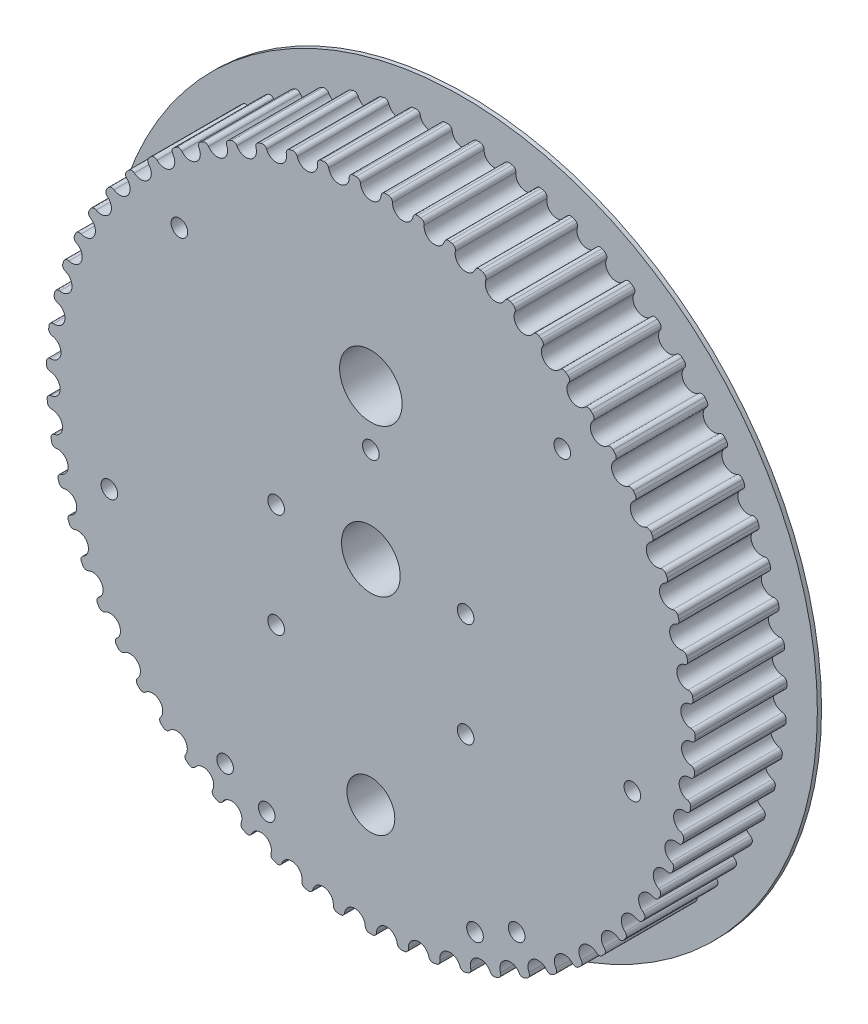
from build123d import *

# Parameters (mm, degrees)
BOSS_EXTRUDE1_DEPTH = 22
SKETCH2_R           = 85.214091318
BOSS_EXTRUDE2_DEPTH = 1
SKETCH3_R           = 7.05
SKETCH3_R_2         = 5.75
SKETCH3_R_3         = 7.5
CUT_EXTRUDE1_DEPTH  = 123.686114611
SKETCH4_R           = 2
CUT_EXTRUDE2_DEPTH  = 18


with BuildPart() as part:
    # Sketch1 → Boss-Extrude1 (new body)
    with BuildSketch(Plane.XY):
        with BuildLine():
            ThreePointArc((2.48146659, 76.908121514), (0, 74.624091318), (-2.48146659, 76.908121514))
            ThreePointArc((-2.48146659, 76.908121514), (-2.817624817, 77.57630379), (-3.523265194, 77.824379512))
            ThreePointArc((-3.523265194, 77.824379512), (-3.703241715, 77.81602306), (-3.883198428, 77.807250395))
            ThreePointArc((-3.883198428, 77.807250395), (-4.063134372, 77.798061565), (-4.243048583, 77.788456617))
            ThreePointArc((-4.243048583, 77.788456617), (-4.920482109, 77.471354546), (-5.188440419, 76.773022067))
            ThreePointArc((-5.188440419, 76.773022067), (-7.430160077, 74.253267445), (-10.12671167, 76.278873497))
            ThreePointArc((-10.12671167, 76.278873497), (-10.527728921, 76.910264875), (-11.254563179, 77.08684876))
            ThreePointArc((-11.254563179, 77.08684876), (-11.432813322, 77.060613959), (-11.611002314, 77.033966985))
            ThreePointArc((-11.611002314, 77.033966985), (-11.789129204, 77.006907981), (-11.967193036, 76.979437092))
            ThreePointArc((-11.967193036, 76.979437092), (-12.609687073, 76.596460174), (-12.806782377, 75.874917834))
            ThreePointArc((-12.806782377, 75.874917834), (-14.786475884, 73.144481241), (-17.67131294, 74.891531766))
            ThreePointArc((-17.67131294, 74.891531766), (-18.133203726, 75.479857193), (-18.874008258, 75.583194272))
            ThreePointArc((-18.874008258, 75.583194272), (-19.048760494, 75.539341854), (-19.223410843, 75.495085401))
            ThreePointArc((-19.223410843, 75.495085401), (-19.397958373, 75.450425149), (-19.572402149, 75.405361336))
            ThreePointArc((-19.572402149, 75.405361336), (-20.173571302, 74.960315769), (-20.297844778, 74.22273458))
            ThreePointArc((-20.297844778, 74.22273458), (-21.995837052, 71.30875232), (-25.040288763, 72.759884345))
            ThreePointArc((-25.040288763, 72.759884345), (-25.558462605, 73.299296781), (-26.305874964, 73.328360042))
            ThreePointArc((-26.305874964, 73.328360042), (-26.475392525, 73.267325833), (-26.644768478, 73.205899741))
            ThreePointArc((-26.644768478, 73.205899741), (-26.814001917, 73.144082094), (-26.983091936, 73.081873222))
            ThreePointArc((-26.983091936, 73.081873222), (-27.536961516, 72.579182069), (-27.587178078, 71.832892444))
            ThreePointArc((-27.587178078, 71.832892444), (-28.986593708, 68.764324982), (-32.160402946, 69.905116505))
            ThreePointArc((-32.160402946, 69.905116505), (-32.729710001, 70.390255026), (-33.476302066, 70.344755626))
            ThreePointArc((-33.476302066, 70.344755626), (-33.638900212, 70.267146211), (-33.801318434, 70.18916096))
            ThreePointArc((-33.801318434, 70.18916096), (-33.963555864, 70.11080029), (-34.125611633, 70.032064619))
            ThreePointArc((-34.125611633, 70.032064619), (-34.626677035, 69.476723849), (-34.602337609, 68.729142751))
            ThreePointArc((-34.602337609, 68.729142751), (-35.689268574, 65.536486889), (-38.960892596, 66.355600211))
            ThreePointArc((-38.960892596, 66.355600211), (-39.575674834, 66.781643292), (-40.314026638, 66.662033425))
            ThreePointArc((-40.314026638, 66.662033425), (-40.468089395, 66.568620121), (-40.621935701, 66.474850764))
            ThreePointArc((-40.621935701, 66.474850764), (-40.775564733, 66.380725854), (-40.92897567, 66.286245894))
            ThreePointArc((-40.92897567, 66.286245894), (-41.37225708, 65.683774735), (-41.273603563, 64.942331958))
            ThreePointArc((-41.273603563, 64.942331958), (-42.037247454, 61.657317745), (-45.374171391, 62.146612151))
            ThreePointArc((-45.374171391, 62.146612151), (-46.02831883, 62.509325584), (-46.751092302, 62.316793986))
            ThreePointArc((-46.751092302, 62.316793986), (-46.895088524, 62.208505178), (-47.03883392, 62.099883635))
            ThreePointArc((-47.03883392, 62.099883635), (-47.182327721, 61.990929941), (-47.325569158, 61.881644677))
            ThreePointArc((-47.325569158, 61.881644677), (-47.706661048, 61.238030757), (-47.534673901, 60.510095095))
            ThreePointArc((-47.534673901, 60.510095095), (-47.967441284, 57.165370477), (-51.336501286, 57.319983138))
            ThreePointArc((-51.336501286, 57.319983138), (-52.023512715, 57.615762115), (-52.723524606, 57.352222252))
            ThreePointArc((-52.723524606, 57.352222252), (-52.856023196, 57.230134161), (-52.988239076, 57.107739964))
            ThreePointArc((-52.988239076, 57.107739964), (-53.120171538, 56.985040316), (-53.251819879, 56.862035874))
            ThreePointArc((-53.251819879, 56.862035874), (-53.566934785, 56.183675717), (-53.323323294, 55.47648172))
            ThreePointArc((-53.323323294, 55.47648172), (-53.420913131, 52.105288075), (-56.788625967, 51.923682381))
            ThreePointArc((-56.788625967, 51.923682381), (-57.501673558, 52.149587317), (-58.171966836, 51.817658367))
            ThreePointArc((-58.171966836, 51.817658367), (-58.291650962, 51.682984359), (-58.411023305, 51.548033916))
            ThreePointArc((-58.411023305, 51.548033916), (-58.530083226, 51.412807759), (-58.648830088, 51.277306612))
            ThreePointArc((-58.648830088, 51.277306612), (-58.894836258, 50.570942066), (-58.582021544, 49.891518147))
            ThreePointArc((-58.582021544, 49.891518147), (-58.343463943, 46.52735991), (-61.67635977, 46.011340741))
            ThreePointArc((-61.67635977, 46.011340741), (-62.408356935, 46.165126492), (-63.042269924, 45.768107312))
            ThreePointArc((-63.042269924, 45.768107312), (-63.147950112, 45.622185839), (-63.253292542, 45.476020348))
            ThreePointArc((-63.253292542, 45.476020348), (-63.35829665, 45.329611621), (-63.462961876, 45.18296044))
            ThreePointArc((-63.462961876, 45.18296044), (-63.637414389, 44.455611673), (-63.258505345, 43.810710252))
            ThreePointArc((-63.258505345, 43.810710252), (-62.686171199, 40.487021939), (-65.9511262, 39.641717725))
            ThreePointArc((-65.9511262, 39.641717725), (-66.694798023, 39.721855898), (-67.286030611, 39.263692245))
            ThreePointArc((-67.286030611, 39.263692245), (-67.376656564, 39.10797354), (-67.46692214, 38.952045659))
            ThreePointArc((-67.46692214, 38.952045659), (-67.556826858, 38.795909436), (-67.646370236, 38.639565707))
            ThreePointArc((-67.646370236, 38.639565707), (-67.747535305, 37.898461439), (-67.306297699, 37.294491835))
            ThreePointArc((-67.306297699, 37.294491835), (-66.405875122, 34.044305755), (-69.570440708, 32.878117508))
            ThreePointArc((-69.570440708, 32.878117508), (-70.318396244, 32.883811655), (-70.861072497, 32.369056964))
            ThreePointArc((-70.861072497, 32.369056964), (-70.935743532, 32.20508863), (-71.010035156, 32.04094804))
            ThreePointArc((-71.010035156, 32.04094804), (-71.083946969, 31.876636074), (-71.157478577, 31.712153611))
            ThreePointArc((-71.157478577, 31.712153611), (-71.184350778, 30.964659268), (-70.685169829, 30.407624003))
            ThreePointArc((-70.685169829, 30.407624003), (-69.465607625, 27.263241965), (-72.498332921, 25.787759789))
            ThreePointArc((-72.498332921, 25.787759789), (-73.243138652, 25.718953318), (-73.731865208, 25.152723453))
            ThreePointArc((-73.731865208, 25.152723453), (-73.789839212, 24.98213508), (-73.847418539, 24.811413085))
            ThreePointArc((-73.847418539, 24.811413085), (-73.904602879, 24.640558382), (-73.961391928, 24.469571885))
            ThreePointArc((-73.961391928, 24.469571885), (-73.913704193, 23.723116402), (-73.361540984, 23.218551543))
            ThreePointArc((-73.361540984, 23.218551543), (-71.83495971, 20.211223827), (-74.70570413, 18.441111727))
            ThreePointArc((-74.70570413, 18.441111727), (-75.439957841, 18.298488468), (-75.869877517, 17.686410876))
            ThreePointArc((-75.869877517, 17.686410876), (-75.910578319, 17.510897847), (-75.950873099, 17.335291159))
            ThreePointArc((-75.950873099, 17.335291159), (-75.990761643, 17.15959175), (-76.030243737, 16.98380056))
            ThreePointArc((-76.030243737, 16.98380056), (-75.908470008, 16.245802548), (-75.308812185, 15.798722686))
            ThreePointArc((-75.308812185, 15.798722686), (-73.490383692, 12.958337467), (-76.170616488, 10.911187612))
            ThreePointArc((-76.170616488, 10.911187612), (-76.887020837, 10.696165019), (-77.253860898, 10.044322801))
            ThreePointArc((-77.253860898, 10.044322801), (-77.276883994, 9.865629445), (-77.299493761, 9.686883322))
            ThreePointArc((-77.299493761, 9.686883322), (-77.321690077, 9.508085386), (-77.343472825, 9.329236595))
            ThreePointArc((-77.343472825, 9.329236595), (-77.148823344, 8.607030608), (-76.507630577, 8.221879025))
            ThreePointArc((-76.507630577, 8.221879025), (-74.415427224, 5.576665328), (-76.878511038, 3.272823212))
            ThreePointArc((-76.878511038, 3.272823212), (-77.569946077, 2.987538276), (-77.870060701, 2.302409734))
            ThreePointArc((-77.870060701, 2.302409734), (-77.875177277, 2.122311986), (-77.879877325, 1.942202886))
            ThreePointArc((-77.879877325, 1.942202886), (-77.884160817, 1.762083398), (-77.888027733, 1.581954485))
            ThreePointArc((-77.888027733, 1.581954485), (-77.622437014, 0.882718132), (-76.946081764, 0.563322636))
            ThreePointArc((-76.946081764, 0.563322636), (-74.600896808, -1.860430217), (-76.822352407, -4.398067976))
            ThreePointArc((-76.822352407, -4.398067976), (-77.481946343, -4.750779964), (-77.712352856, -5.462385715))
            ThreePointArc((-77.712352856, -5.462385715), (-77.699512062, -5.642097964), (-77.686255679, -5.821780035))
            ThreePointArc((-77.686255679, -5.821780035), (-77.672583776, -6.001430967), (-77.658496428, -6.181049799))
            ThreePointArc((-77.658496428, -6.181049799), (-77.324604031, -6.850367194), (-76.619808221, -7.100832306))
            ThreePointArc((-76.619808221, -7.100832306), (-74.044949163, -9.27903597), (-76.002698723, -12.025249187))
            ThreePointArc((-76.002698723, -12.025249187), (-76.623896215, -12.441882819), (-76.782304735, -13.172893522))
            ThreePointArc((-76.782304735, -13.172893522), (-76.751634188, -13.350434209), (-76.720553122, -13.52790349))
            ThreePointArc((-76.720553122, -13.52790349), (-76.689061702, -13.705300415), (-76.657160097, -13.882624034))
            ThreePointArc((-76.657160097, -13.882624034), (-76.258284394, -14.515370493), (-75.532052601, -14.694415986))
            ThreePointArc((-75.532052601, -14.694415986), (-72.753109547, -16.605422496), (-74.427696074, -19.53291807))
            ThreePointArc((-74.427696074, -19.53291807), (-75.004323383, -20.009332652), (-75.089159573, -20.752483194))
            ThreePointArc((-75.089159573, -20.752483194), (-75.040964091, -20.926087842), (-74.99236724, -21.099580563))
            ThreePointArc((-74.99236724, -21.099580563), (-74.943369278, -21.272960429), (-74.893970468, -21.446226513))
            ThreePointArc((-74.893970468, -21.446226513), (-74.434075667, -22.036113518), (-73.693625507, -22.141959958))
            ThreePointArc((-73.693625507, -22.141959958), (-70.738216844, -23.766776872), (-72.112997543, -26.846460038))
            ThreePointArc((-72.112997543, -26.846460038), (-72.639323888, -27.377920748), (-72.649744609, -28.125825364))
            ThreePointArc((-72.649744609, -28.125825364), (-72.58450318, -28.293768612), (-72.51887352, -28.461560525))
            ThreePointArc((-72.51887352, -28.461560525), (-72.45285598, -28.629200206), (-72.386450914, -28.796686759))
            ThreePointArc((-72.386450914, -28.796686759), (-71.870107654, -29.337851747), (-71.122798056, -29.369447185))
            ThreePointArc((-71.122798056, -29.369447185), (-68.02029596, -30.691926342), (-69.081607645, -33.893189824))
            ThreePointArc((-69.081607645, -33.893189824), (-69.552402157, -34.474414767), (-69.488303843, -35.219640447))
            ThreePointArc((-69.488303843, -35.219640447), (-69.406664866, -35.380253197), (-69.324654655, -35.540676711))
            ThreePointArc((-69.324654655, -35.540676711), (-69.242273649, -35.700910129), (-69.159522289, -35.860952594))
            ThreePointArc((-69.159522289, -35.860952594), (-68.591862222, -36.348017226), (-67.845120284, -36.305047651))
            ThreePointArc((-67.845120284, -36.305047651), (-64.626358816, -37.312045659), (-65.363653693, -40.603073863))
            ThreePointArc((-65.363653693, -40.603073863), (-65.774237406, -41.228286564), (-65.636257094, -41.963426919))
            ThreePointArc((-65.636257094, -41.963426919), (-65.539031934, -42.115112932), (-65.441456227, -42.266573685))
            ThreePointArc((-65.441456227, -42.266573685), (-65.343530494, -42.417808367), (-65.24525526, -42.56881617))
            ThreePointArc((-65.24525526, -42.56881617), (-64.631920047, -42.996939778), (-63.893167225, -42.879832242))
            ThreePointArc((-63.893167225, -42.879832242), (-60.590135883, -43.561341103), (-60.996086385, -46.909426312))
            ThreePointArc((-60.996086385, -46.909426312), (-61.342378733, -47.572413127), (-61.131887735, -48.290162002))
            ThreePointArc((-61.131887735, -48.290162002), (-61.020042658, -48.431413753), (-60.907871206, -48.57240646))
            ThreePointArc((-60.907871206, -48.57240646), (-60.795373976, -48.713139369), (-60.682551572, -48.853611727))
            ThreePointArc((-60.682551572, -48.853611727), (-60.029636814, -49.218539426), (-59.306215166, -49.028457797))
            ThreePointArc((-59.306215166, -49.028457797), (-55.951740959, -49.377704369), (-56.022312567, -52.749571807))
            ThreePointArc((-56.022312567, -52.749571807), (-56.300871941, -53.443743675), (-56.01996221, -54.136967759))
            ThreePointArc((-56.01996221, -54.136967759), (-55.894608784, -54.266381425), (-55.768956396, -54.395504838))
            ThreePointArc((-55.768956396, -54.395504838), (-55.643005719, -54.524337307), (-55.516757424, -54.652878142))
            ThreePointArc((-55.516757424, -54.652878142), (-54.830752081, -54.950983117), (-54.129851296, -54.68981651))
            ThreePointArc((-54.129851296, -54.68981651), (-50.757272496, -54.703329824), (-50.491763838, -58.065468359))
            ThreePointArc((-50.491763838, -58.065468359), (-50.699821789, -58.783926288), (-50.351285133, -59.445736009))
            ThreePointArc((-50.351285133, -59.445736009), (-50.213669176, -59.562025419), (-50.075784643, -59.677996251))
            ThreePointArc((-50.075784643, -59.677996251), (-49.937632271, -59.793647884), (-49.799212798, -59.908979701))
            ThreePointArc((-49.799212798, -59.908979701), (-49.0869347, -60.13729925), (-48.415520645, -59.807643257))
            ThreePointArc((-48.415520645, -59.807643257), (-45.058355455, -59.485289012), (-44.459405275, -62.8042842))
            ThreePointArc((-44.459405275, -62.8042842), (-44.594894031, -63.539887832), (-44.182194362, -64.163705827))
            ThreePointArc((-44.182194362, -64.163705827), (-44.033683565, -64.265715244), (-43.884937245, -64.367380925))
            ThreePointArc((-43.884937245, -64.367380925), (-43.735956199, -64.468702325), (-43.586741223, -64.569678903))
            ThreePointArc((-43.586741223, -64.569678903), (-42.855269308, -64.725943885), (-42.220014798, -64.331074775))
            ThreePointArc((-42.220014798, -64.331074775), (-38.911628234, -63.676056672), (-37.985189168, -66.918922847))
            ThreePointArc((-37.985189168, -66.918922847), (-38.04676218, -67.664361424), (-37.574001095, -68.24398791))
            ThreePointArc((-37.574001095, -68.24398791), (-37.416071423, -68.330703519), (-37.257941624, -68.41705365))
            ThreePointArc((-37.257941624, -68.41705365), (-37.099612544, -68.503037839), (-36.941085031, -68.588655628))
            ThreePointArc((-36.941085031, -68.588655628), (-36.197688996, -68.671313011), (-35.604907476, -68.21515517))
            ThreePointArc((-35.604907476, -68.21515517), (-32.378179769, -67.233983073), (-31.133459186, -70.368491176))
            ThreePointArc((-31.133459186, -70.368491176), (-31.120504514, -71.116356192), (-30.592380524, -71.646030581))
            ThreePointArc((-30.592380524, -71.646030581), (-30.426601553, -71.716590564), (-30.26065984, -71.786766957))
            ThreePointArc((-30.26065984, -71.786766957), (-30.094556273, -71.856559387), (-29.928291739, -71.925967478))
            ThreePointArc((-29.928291739, -71.925967478), (-29.180359789, -71.934195776), (-28.635942587, -71.421282706))
            ThreePointArc((-28.635942587, -71.421282706), (-25.522942408, -70.123707945), (-23.972310899, -73.118705824))
            ThreePointArc((-23.972310899, -73.118705824), (-23.884957293, -73.861564663), (-23.306719131, -74.336022812))
            ThreePointArc((-23.306719131, -74.336022812), (-23.134738447, -74.389725911), (-22.962634024, -74.443031123))
            ThreePointArc((-22.962634024, -74.443031123), (-22.790406781, -74.495938164), (-22.618057639, -74.54844675))
            ThreePointArc((-22.618057639, -74.54844675), (-21.873023056, -74.482164185), (-21.382380835, -73.917593447))
            ThreePointArc((-21.382380835, -73.917593447), (-18.414046579, -72.316511902), (-16.572915017, -75.142233924))
            ThreePointArc((-16.572915017, -75.142233924), (-16.412030635, -75.87270372), (-15.789425092, -76.287230251))
            ThreePointArc((-15.789425092, -76.287230251), (-15.612951917, -76.323542741), (-15.436395234, -76.359447001))
            ThreePointArc((-15.436395234, -76.359447001), (-15.259755987, -76.394942839), (-15.083035119, -76.430030065))
            ThreePointArc((-15.083035119, -76.430030065), (-14.348302394, -76.289895384), (-13.916311377, -75.679277936))
            ThreePointArc((-13.916311377, -75.679277936), (-11.122143681, -73.790601875), (-9.008810059, -76.418964744))
            ThreePointArc((-9.008810059, -76.418964744), (-8.775993843, -77.12978576), (-8.115208653, -77.480260923))
            ThreePointArc((-8.115208653, -77.480260923), (-7.935996857, -77.498821914), (-7.756742614, -77.516968389))
            ThreePointArc((-7.756742614, -77.516968389), (-7.577446882, -77.53470025), (-7.398110621, -77.552017404))
            ThreePointArc((-7.398110621, -77.552017404), (-6.680981856, -77.339423328), (-6.311935363, -76.68882776))
            ThreePointArc((-6.311935363, -76.68882776), (-3.719703923, -74.531327694), (-1.355171499, -76.93620956))
            ThreePointArc((-1.355171499, -76.93620956), (-1.052737282, -77.620317337), (-0.360339625, -77.903257952))
            ThreePointArc((-0.360339625, -77.903257952), (-0.180170294, -77.903882976), (0, -77.904091318))
            ThreePointArc((0, -77.904091318), (0.180170294, -77.903882976), (0.360339625, -77.903257952))
            ThreePointArc((0.360339625, -77.903257952), (1.052737282, -77.620317337), (1.355171499, -76.93620956))
            ThreePointArc((1.355171499, -76.93620956), (3.719703923, -74.531327694), (6.311935363, -76.68882776))
            ThreePointArc((6.311935363, -76.68882776), (6.680981856, -77.339423328), (7.398110621, -77.552017404))
            ThreePointArc((7.398110621, -77.552017404), (7.577446882, -77.53470025), (7.756742614, -77.516968389))
            ThreePointArc((7.756742614, -77.516968389), (7.935996857, -77.498821914), (8.115208653, -77.480260923))
            ThreePointArc((8.115208653, -77.480260923), (8.775993843, -77.12978576), (9.008810059, -76.418964744))
            ThreePointArc((9.008810059, -76.418964744), (11.122143681, -73.790601875), (13.916311377, -75.679277936))
            ThreePointArc((13.916311377, -75.679277936), (14.348302394, -76.289895384), (15.083035119, -76.430030065))
            ThreePointArc((15.083035119, -76.430030065), (15.259755987, -76.394942839), (15.436395234, -76.359447001))
            ThreePointArc((15.436395234, -76.359447001), (15.612951917, -76.323542741), (15.789425092, -76.287230251))
            ThreePointArc((15.789425092, -76.287230251), (16.412030635, -75.87270372), (16.572915017, -75.142233924))
            ThreePointArc((16.572915017, -75.142233924), (18.414046579, -72.316511902), (21.382380835, -73.917593447))
            ThreePointArc((21.382380835, -73.917593447), (21.873023056, -74.482164185), (22.618057639, -74.54844675))
            ThreePointArc((22.618057639, -74.54844675), (22.79040678, -74.495938164), (22.962634024, -74.443031123))
            ThreePointArc((22.962634024, -74.443031123), (23.134738447, -74.389725911), (23.306719131, -74.336022812))
            ThreePointArc((23.306719131, -74.336022812), (23.884957293, -73.861564663), (23.972310899, -73.118705824))
            ThreePointArc((23.972310899, -73.118705824), (25.522942408, -70.123707945), (28.635942587, -71.421282706))
            ThreePointArc((28.635942587, -71.421282706), (29.180359789, -71.934195776), (29.928291739, -71.925967478))
            ThreePointArc((29.928291739, -71.925967478), (30.094556273, -71.856559387), (30.26065984, -71.786766957))
            ThreePointArc((30.26065984, -71.786766957), (30.426601553, -71.716590564), (30.592380524, -71.646030581))
            ThreePointArc((30.592380524, -71.646030581), (31.120504514, -71.116356192), (31.133459186, -70.368491176))
            ThreePointArc((31.133459186, -70.368491176), (32.378179769, -67.233983073), (35.604907476, -68.21515517))
            ThreePointArc((35.604907476, -68.21515517), (36.197688996, -68.671313011), (36.941085031, -68.588655628))
            ThreePointArc((36.941085031, -68.588655628), (37.099612544, -68.503037839), (37.257941624, -68.41705365))
            ThreePointArc((37.257941624, -68.41705365), (37.416071423, -68.330703519), (37.574001095, -68.24398791))
            ThreePointArc((37.574001095, -68.24398791), (38.04676218, -67.664361424), (37.985189168, -66.918922847))
            ThreePointArc((37.985189168, -66.918922847), (38.911628234, -63.676056672), (42.220014798, -64.331074775))
            ThreePointArc((42.220014798, -64.331074775), (42.855269308, -64.725943885), (43.586741223, -64.569678903))
            ThreePointArc((43.586741223, -64.569678903), (43.735956199, -64.468702325), (43.884937245, -64.367380925))
            ThreePointArc((43.884937245, -64.367380925), (44.033683565, -64.265715244), (44.182194362, -64.163705827))
            ThreePointArc((44.182194362, -64.163705827), (44.594894031, -63.539887832), (44.459405275, -62.8042842))
            ThreePointArc((44.459405275, -62.8042842), (45.058355455, -59.485289012), (48.415520645, -59.807643257))
            ThreePointArc((48.415520645, -59.807643257), (49.0869347, -60.13729925), (49.799212798, -59.908979701))
            ThreePointArc((49.799212798, -59.908979701), (49.937632271, -59.793647884), (50.075784643, -59.677996251))
            ThreePointArc((50.075784643, -59.677996251), (50.213669176, -59.562025419), (50.351285133, -59.445736009))
            ThreePointArc((50.351285133, -59.445736009), (50.699821789, -58.783926288), (50.491763838, -58.065468359))
            ThreePointArc((50.491763838, -58.065468359), (50.757272496, -54.703329824), (54.129851296, -54.68981651))
            ThreePointArc((54.129851296, -54.68981651), (54.830752081, -54.950983117), (55.516757424, -54.652878142))
            ThreePointArc((55.516757424, -54.652878142), (55.643005719, -54.524337307), (55.768956396, -54.395504838))
            ThreePointArc((55.768956396, -54.395504838), (55.894608784, -54.266381425), (56.01996221, -54.136967759))
            ThreePointArc((56.01996221, -54.136967759), (56.300871941, -53.443743675), (56.022312567, -52.749571807))
            ThreePointArc((56.022312567, -52.749571807), (55.951740959, -49.377704369), (59.306215166, -49.028457797))
            ThreePointArc((59.306215166, -49.028457797), (60.029636814, -49.218539426), (60.682551572, -48.853611727))
            ThreePointArc((60.682551572, -48.853611727), (60.795373976, -48.713139369), (60.907871206, -48.57240646))
            ThreePointArc((60.907871206, -48.57240646), (61.020042658, -48.431413753), (61.131887735, -48.290162002))
            ThreePointArc((61.131887735, -48.290162002), (61.342378733, -47.572413127), (60.996086385, -46.909426312))
            ThreePointArc((60.996086385, -46.909426312), (60.590135883, -43.561341103), (63.893167225, -42.879832242))
            ThreePointArc((63.893167225, -42.879832242), (64.631920047, -42.996939778), (65.24525526, -42.56881617))
            ThreePointArc((65.24525526, -42.56881617), (65.343530494, -42.417808367), (65.441456227, -42.266573685))
            ThreePointArc((65.441456227, -42.266573685), (65.539031934, -42.115112932), (65.636257094, -41.963426919))
            ThreePointArc((65.636257094, -41.963426919), (65.774237406, -41.228286564), (65.363653693, -40.603073863))
            ThreePointArc((65.363653693, -40.603073863), (64.626358816, -37.312045659), (67.845120284, -36.305047651))
            ThreePointArc((67.845120284, -36.305047651), (68.591862222, -36.348017226), (69.159522289, -35.860952594))
            ThreePointArc((69.159522289, -35.860952594), (69.242273649, -35.700910129), (69.324654655, -35.540676711))
            ThreePointArc((69.324654655, -35.540676711), (69.406664866, -35.380253197), (69.488303843, -35.219640447))
            ThreePointArc((69.488303843, -35.219640447), (69.552402157, -34.474414767), (69.081607645, -33.893189824))
            ThreePointArc((69.081607645, -33.893189824), (68.02029596, -30.691926342), (71.122798056, -29.369447185))
            ThreePointArc((71.122798056, -29.369447185), (71.870107654, -29.337851747), (72.386450914, -28.796686759))
            ThreePointArc((72.386450914, -28.796686759), (72.45285598, -28.629200206), (72.51887352, -28.461560525))
            ThreePointArc((72.51887352, -28.461560525), (72.58450318, -28.293768612), (72.649744609, -28.125825364))
            ThreePointArc((72.649744609, -28.125825364), (72.639323888, -27.377920748), (72.112997543, -26.846460038))
            ThreePointArc((72.112997543, -26.846460038), (70.738216844, -23.766776872), (73.693625507, -22.141959958))
            ThreePointArc((73.693625507, -22.141959958), (74.434075667, -22.036113518), (74.893970468, -21.446226513))
            ThreePointArc((74.893970468, -21.446226513), (74.943369278, -21.272960429), (74.99236724, -21.099580563))
            ThreePointArc((74.99236724, -21.099580563), (75.040964091, -20.926087842), (75.089159573, -20.752483194))
            ThreePointArc((75.089159573, -20.752483194), (75.004323383, -20.009332652), (74.427696074, -19.53291807))
            ThreePointArc((74.427696074, -19.53291807), (72.753109547, -16.605422496), (75.532052601, -14.694415986))
            ThreePointArc((75.532052601, -14.694415986), (76.258284394, -14.515370493), (76.657160097, -13.882624034))
            ThreePointArc((76.657160097, -13.882624034), (76.689061702, -13.705300415), (76.720553122, -13.52790349))
            ThreePointArc((76.720553122, -13.52790349), (76.751634188, -13.350434209), (76.782304735, -13.172893522))
            ThreePointArc((76.782304735, -13.172893522), (76.623896215, -12.441882819), (76.002698723, -12.025249187))
            ThreePointArc((76.002698723, -12.025249187), (74.044949163, -9.27903597), (76.619808221, -7.100832306))
            ThreePointArc((76.619808221, -7.100832306), (77.324604031, -6.850367194), (77.658496428, -6.181049799))
            ThreePointArc((77.658496428, -6.181049799), (77.672583776, -6.001430967), (77.686255679, -5.821780035))
            ThreePointArc((77.686255679, -5.821780035), (77.699512062, -5.642097964), (77.712352856, -5.462385715))
            ThreePointArc((77.712352856, -5.462385715), (77.481946343, -4.750779964), (76.822352407, -4.398067976))
            ThreePointArc((76.822352407, -4.398067976), (74.600896808, -1.860430217), (76.946081764, 0.563322636))
            ThreePointArc((76.946081764, 0.563322636), (77.622437014, 0.882718132), (77.888027733, 1.581954485))
            ThreePointArc((77.888027733, 1.581954485), (77.884160817, 1.762083398), (77.879877325, 1.942202886))
            ThreePointArc((77.879877325, 1.942202886), (77.875177277, 2.122311986), (77.870060701, 2.302409734))
            ThreePointArc((77.870060701, 2.302409734), (77.569946077, 2.987538276), (76.878511038, 3.272823212))
            ThreePointArc((76.878511038, 3.272823212), (74.415427224, 5.576665328), (76.507630577, 8.221879025))
            ThreePointArc((76.507630577, 8.221879025), (77.148823344, 8.607030608), (77.343472825, 9.329236595))
            ThreePointArc((77.343472825, 9.329236595), (77.321690077, 9.508085386), (77.299493761, 9.686883322))
            ThreePointArc((77.299493761, 9.686883322), (77.276883994, 9.865629445), (77.253860898, 10.044322801))
            ThreePointArc((77.253860898, 10.044322801), (76.887020837, 10.696165019), (76.170616488, 10.911187612))
            ThreePointArc((76.170616488, 10.911187612), (73.490383692, 12.958337467), (75.308812185, 15.798722686))
            ThreePointArc((75.308812185, 15.798722686), (75.908470008, 16.245802548), (76.030243737, 16.98380056))
            ThreePointArc((76.030243737, 16.98380056), (75.990761643, 17.15959175), (75.950873099, 17.335291159))
            ThreePointArc((75.950873099, 17.335291159), (75.910578319, 17.510897847), (75.869877517, 17.686410876))
            ThreePointArc((75.869877517, 17.686410876), (75.439957841, 18.298488468), (74.70570413, 18.441111727))
            ThreePointArc((74.70570413, 18.441111727), (71.83495971, 20.211223827), (73.361540984, 23.218551543))
            ThreePointArc((73.361540984, 23.218551543), (73.913704193, 23.723116402), (73.961391928, 24.469571885))
            ThreePointArc((73.961391928, 24.469571885), (73.904602879, 24.640558382), (73.847418539, 24.811413085))
            ThreePointArc((73.847418539, 24.811413085), (73.789839212, 24.98213508), (73.731865208, 25.152723453))
            ThreePointArc((73.731865208, 25.152723453), (73.243138652, 25.718953318), (72.498332921, 25.787759789))
            ThreePointArc((72.498332921, 25.787759789), (69.465607625, 27.263241965), (70.685169829, 30.407624003))
            ThreePointArc((70.685169829, 30.407624003), (71.184350778, 30.964659268), (71.157478577, 31.712153611))
            ThreePointArc((71.157478577, 31.712153611), (71.083946969, 31.876636074), (71.010035156, 32.04094804))
            ThreePointArc((71.010035156, 32.04094804), (70.935743532, 32.20508863), (70.861072497, 32.369056964))
            ThreePointArc((70.861072497, 32.369056964), (70.318396244, 32.883811655), (69.570440708, 32.878117508))
            ThreePointArc((69.570440708, 32.878117508), (66.405875122, 34.044305755), (67.306297699, 37.294491835))
            ThreePointArc((67.306297699, 37.294491835), (67.747535305, 37.898461439), (67.646370236, 38.639565707))
            ThreePointArc((67.646370236, 38.639565707), (67.556826858, 38.795909436), (67.46692214, 38.952045659))
            ThreePointArc((67.46692214, 38.952045659), (67.376656564, 39.10797354), (67.286030611, 39.263692245))
            ThreePointArc((67.286030611, 39.263692245), (66.694798023, 39.721855898), (65.9511262, 39.641717725))
            ThreePointArc((65.9511262, 39.641717725), (62.686171199, 40.487021939), (63.258505345, 43.810710252))
            ThreePointArc((63.258505345, 43.810710252), (63.637414389, 44.455611673), (63.462961876, 45.18296044))
            ThreePointArc((63.462961876, 45.18296044), (63.35829665, 45.329611621), (63.253292542, 45.476020348))
            ThreePointArc((63.253292542, 45.476020348), (63.147950112, 45.622185839), (63.042269924, 45.768107312))
            ThreePointArc((63.042269924, 45.768107312), (62.408356935, 46.165126492), (61.67635977, 46.011340741))
            ThreePointArc((61.67635977, 46.011340741), (58.343463943, 46.52735991), (58.582021544, 49.891518147))
            ThreePointArc((58.582021544, 49.891518147), (58.894836258, 50.570942066), (58.648830088, 51.277306612))
            ThreePointArc((58.648830088, 51.277306612), (58.530083226, 51.412807759), (58.411023305, 51.548033916))
            ThreePointArc((58.411023305, 51.548033916), (58.291650962, 51.682984359), (58.171966836, 51.817658367))
            ThreePointArc((58.171966836, 51.817658367), (57.501673558, 52.149587317), (56.788625967, 51.923682381))
            ThreePointArc((56.788625967, 51.923682381), (53.420913131, 52.105288075), (53.323323294, 55.47648172))
            ThreePointArc((53.323323294, 55.47648172), (53.566934785, 56.183675717), (53.251819879, 56.862035874))
            ThreePointArc((53.251819879, 56.862035874), (53.120171538, 56.985040316), (52.988239076, 57.107739964))
            ThreePointArc((52.988239076, 57.107739964), (52.856023196, 57.230134161), (52.723524606, 57.352222252))
            ThreePointArc((52.723524606, 57.352222252), (52.023512715, 57.615762115), (51.336501286, 57.319983138))
            ThreePointArc((51.336501286, 57.319983138), (47.967441284, 57.165370477), (47.534673901, 60.510095095))
            ThreePointArc((47.534673901, 60.510095095), (47.706661048, 61.238030757), (47.325569158, 61.881644677))
            ThreePointArc((47.325569158, 61.881644677), (47.182327721, 61.990929941), (47.03883392, 62.099883635))
            ThreePointArc((47.03883392, 62.099883635), (46.895088524, 62.208505178), (46.751092302, 62.316793986))
            ThreePointArc((46.751092302, 62.316793986), (46.02831883, 62.509325584), (45.374171391, 62.146612151))
            ThreePointArc((45.374171391, 62.146612151), (42.037247454, 61.657317745), (41.273603563, 64.942331958))
            ThreePointArc((41.273603563, 64.942331958), (41.37225708, 65.683774735), (40.92897567, 66.286245894))
            ThreePointArc((40.92897567, 66.286245894), (40.775564733, 66.380725854), (40.621935701, 66.474850764))
            ThreePointArc((40.621935701, 66.474850764), (40.468089395, 66.568620121), (40.314026638, 66.662033425))
            ThreePointArc((40.314026638, 66.662033425), (39.575674834, 66.781643292), (38.960892596, 66.355600211))
            ThreePointArc((38.960892596, 66.355600211), (35.689268574, 65.536486889), (34.602337609, 68.729142751))
            ThreePointArc((34.602337609, 68.729142751), (34.626677035, 69.476723849), (34.125611633, 70.032064619))
            ThreePointArc((34.125611633, 70.032064619), (33.963555864, 70.11080029), (33.801318434, 70.18916096))
            ThreePointArc((33.801318434, 70.18916096), (33.638900212, 70.267146211), (33.476302066, 70.344755626))
            ThreePointArc((33.476302066, 70.344755626), (32.729710001, 70.390255026), (32.160402946, 69.905116505))
            ThreePointArc((32.160402946, 69.905116505), (28.986593708, 68.764324982), (27.587178078, 71.832892444))
            ThreePointArc((27.587178078, 71.832892444), (27.536961516, 72.579182069), (26.983091936, 73.081873222))
            ThreePointArc((26.983091936, 73.081873222), (26.814001917, 73.144082094), (26.644768478, 73.205899741))
            ThreePointArc((26.644768478, 73.205899741), (26.475392525, 73.267325833), (26.305874964, 73.328360042))
            ThreePointArc((26.305874964, 73.328360042), (25.558462605, 73.299296781), (25.040288763, 72.759884345))
            ThreePointArc((25.040288763, 72.759884345), (21.995837052, 71.30875232), (20.297844778, 74.22273458))
            ThreePointArc((20.297844778, 74.22273458), (20.173571302, 74.960315769), (19.572402149, 75.405361336))
            ThreePointArc((19.572402149, 75.405361336), (19.397958373, 75.450425149), (19.223410843, 75.495085401))
            ThreePointArc((19.223410843, 75.495085401), (19.048760494, 75.539341854), (18.874008258, 75.583194272))
            ThreePointArc((18.874008258, 75.583194272), (18.133203726, 75.479857193), (17.67131294, 74.891531766))
            ThreePointArc((17.67131294, 74.891531766), (14.786475884, 73.144481241), (12.806782377, 75.874917834))
            ThreePointArc((12.806782377, 75.874917834), (12.609687073, 76.596460174), (11.967193036, 76.979437092))
            ThreePointArc((11.967193036, 76.979437092), (11.789129204, 77.006907981), (11.611002314, 77.033966985))
            ThreePointArc((11.611002314, 77.033966985), (11.432813322, 77.060613959), (11.254563179, 77.08684876))
            ThreePointArc((11.254563179, 77.08684876), (10.527728921, 76.910264875), (10.12671167, 76.278873497))
            ThreePointArc((10.12671167, 76.278873497), (7.430160077, 74.253267445), (5.188440419, 76.773022067))
            ThreePointArc((5.188440419, 76.773022067), (4.920482109, 77.471354546), (4.243048583, 77.788456617))
            ThreePointArc((4.243048583, 77.788456617), (4.063134372, 77.798061565), (3.883198428, 77.807250395))
            ThreePointArc((3.883198428, 77.807250395), (3.703241715, 77.81602306), (3.523265194, 77.824379512))
            ThreePointArc((3.523265194, 77.824379512), (2.817624817, 77.57630379), (2.48146659, 76.908121514))
        make_face()
    extrude(amount=BOSS_EXTRUDE1_DEPTH)

    # Sketch2 → Boss-Extrude2 (add)
    with BuildSketch(Plane(origin=(0, 0, 0), x_dir=(-1, 0, 0), z_dir=(0, 0, -1))):
        Circle(SKETCH2_R)
    extrude(amount=BOSS_EXTRUDE2_DEPTH)

    # Sketch3 → Cut-Extrude1 (cut, through all)
    with BuildSketch(Plane.XY.offset(22)):
        Circle(SKETCH3_R)
        with Locations((0, -51.05)):
            Circle(SKETCH3_R_2)
        with Locations((0, 36)):
            Circle(SKETCH3_R_3)
    extrude(amount=-CUT_EXTRUDE1_DEPTH, mode=Mode.SUBTRACT)

    # Sketch4 → Cut-Extrude2 (cut)
    with BuildSketch(Plane.XY.offset(22)):
        with Locations((-45.961940777, 45.961940777)):
            Circle(SKETCH4_R)
        with Locations((45.961940777, 45.961940777)):
            Circle(SKETCH4_R)
        with Locations((-25, -65)):
            Circle(SKETCH4_R)
        with Locations((25, -65)):
            Circle(SKETCH4_R)
        with Locations((-62.785178709, -16.823237932)):
            Circle(SKETCH4_R)
        with Locations((62.785178709, -16.823237932)):
            Circle(SKETCH4_R)
        with Locations((-35, -60)):
            Circle(SKETCH4_R)
        with Locations((35, -60)):
            Circle(SKETCH4_R)
        with Locations((-22.75, 0)):
            Circle(SKETCH4_R)
        with Locations((22.75, 0)):
            Circle(SKETCH4_R)
        with Locations((0, 22.75)):
            Circle(SKETCH4_R)
        with Locations((-22.75, -25)):
            Circle(SKETCH4_R)
        with Locations((22.75, -25)):
            Circle(SKETCH4_R)
    extrude(amount=-CUT_EXTRUDE2_DEPTH, mode=Mode.SUBTRACT)


solid = part.part
